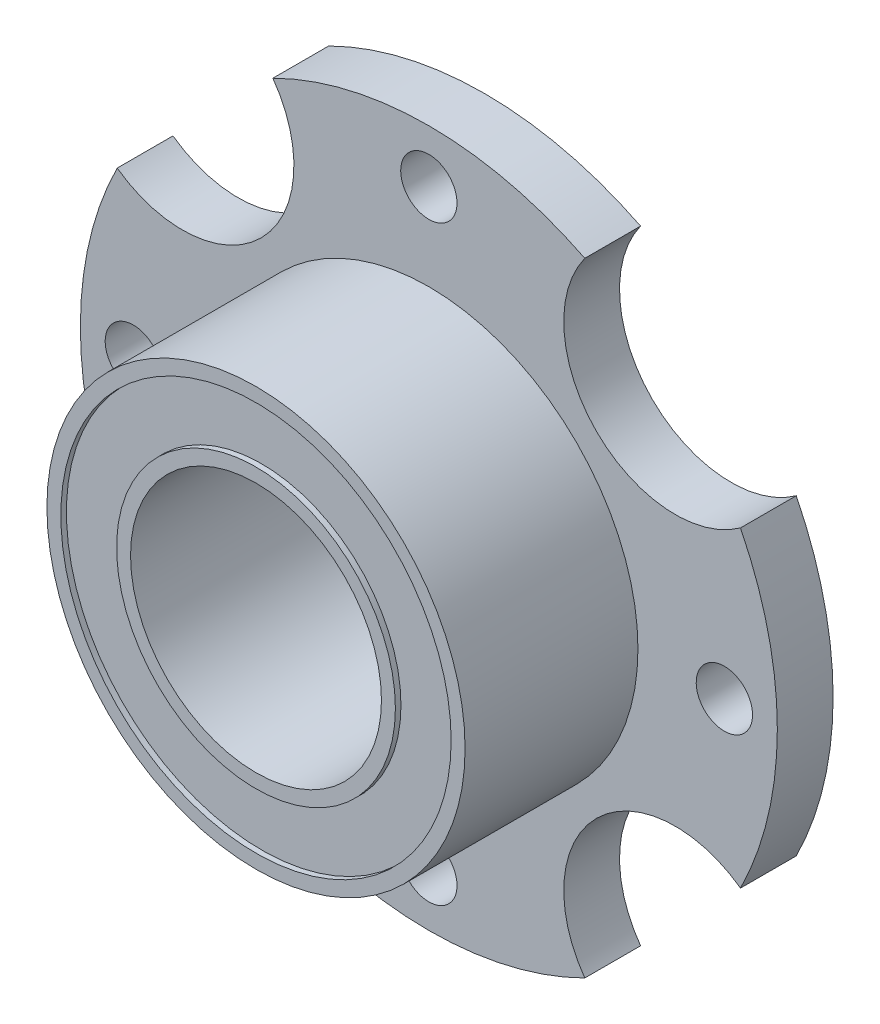
from build123d import *

# Parameters (mm, degrees)
SZKIC1_R                    = 37.5
SZKIC1_R_2                  = 22.5
DODANIE_WYCI_GNI_CIE1_DEPTH = 41
SZKIC2_R                    = 35
SZKIC2_R_2                  = 25
WYTNIJ_WYCI_GNI_CIE1_DEPTH  = 1
SZKIC3_R                    = 5.05
SZKIC3_R_2                  = 37.5
DODANIE_WYCI_GNI_CIE2_DEPTH = 10
SZYK_KO_OWY1_OUTLINE_R      = 5.05
SZYK_KO_OWY1_DEPTH          = 10


# Read off the part's stored shape, not the designer's step: Szyk kołowy1
with BuildPart() as part:
    # Szkic1 → Dodanie-wyciągnięcie1 (new body)
    with BuildSketch(Plane.XY):
        Circle(SZKIC1_R)
        Circle(SZKIC1_R_2, mode=Mode.SUBTRACT)
    extrude(amount=DODANIE_WYCI_GNI_CIE1_DEPTH)

    # Szkic2 → Wytnij-wyciągnięcie1 (cut)
    with BuildSketch(Plane.XY.offset(41)):
        Circle(SZKIC2_R)
        Circle(SZKIC2_R_2, mode=Mode.SUBTRACT)
    wytnij_wyci_gni_cie1 = extrude(amount=-WYTNIJ_WYCI_GNI_CIE1_DEPTH, mode=Mode.SUBTRACT)

    # Lustro1: Wytnij-wyciągnięcie1 across plane
    add(wytnij_wyci_gni_cie1.mirror(Plane.XY.offset(20.5)), mode=Mode.SUBTRACT)

    # Szkic3 → Dodanie-wyciągnięcie2 (add)
    with BuildSketch(Plane.XY):
        with BuildLine():
            ThreePointArc((-27.971489431, -55.891374818), (44.194173824, 44.194173824), (-55.891374818, -27.971489431))
            ThreePointArc((-55.891374818, -27.971489431), (-30.0520382, -30.0520382), (-27.971489431, -55.891374818))
        make_face()
        with Locations((0, -53)):
            Circle(SZKIC3_R, mode=Mode.SUBTRACT)
        Circle(SZKIC3_R_2, mode=Mode.SUBTRACT)
    extrude(amount=DODANIE_WYCI_GNI_CIE2_DEPTH)

    # Szyk kołowy1 outline → Szyk kołowy1 (cut)
    with BuildSketch(Plane.XY):
        with Locations((-53, 0)):
            Circle(SZYK_KO_OWY1_OUTLINE_R)
        with BuildLine():
            ThreePointArc((-55.891374818, 27.971489431), (-30.0520382, 30.0520382), (-27.971489431, 55.891374818))
            ThreePointArc((-27.971489431, 55.891374818), (-44.194173824, 44.194173824), (-55.891374818, 27.971489431))
        make_face()
        with BuildLine():
            ThreePointArc((27.971489431, -55.891374818), (44.194173824, -44.194173824), (55.891374818, -27.971489431))
            ThreePointArc((55.891374818, -27.971489431), (30.0520382, -30.0520382), (27.971489431, -55.891374818))
        make_face()
        with BuildLine():
            ThreePointArc((55.891374818, 27.971489431), (44.194173824, 44.194173824), (27.971489431, 55.891374818))
            ThreePointArc((27.971489431, 55.891374818), (30.0520382, 30.0520382), (55.891374818, 27.971489431))
        make_face()
        with Locations((0, 53)):
            Circle(SZYK_KO_OWY1_OUTLINE_R)
        with Locations((53, 0)):
            Circle(SZYK_KO_OWY1_OUTLINE_R)
    extrude(amount=SZYK_KO_OWY1_DEPTH, mode=Mode.SUBTRACT)


solid = part.part
